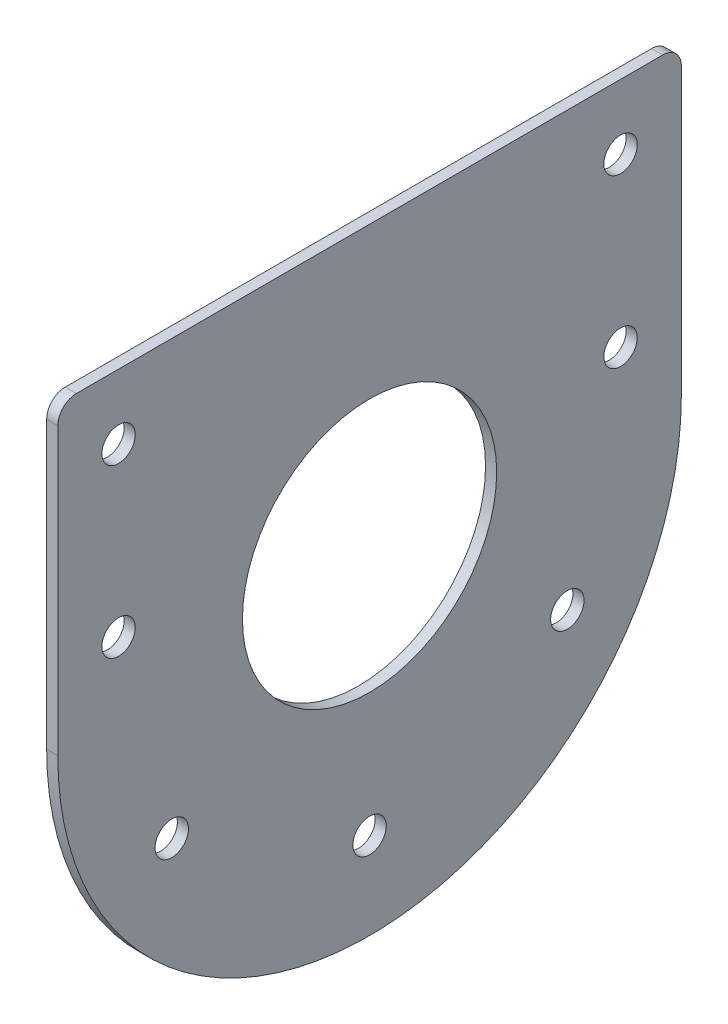
from build123d import *

# Parameters (mm, degrees)
SM_START               = -3
SM_BASE_FLANGE_1_DEPTH = 6
SKETCH_6_R             = 9
SKETCH_6_R_2           = 68.5
CUT_EXTRUDE_1_DEPTH    = 248.757946391
FILLET_1_R             = 10


# Read off the part's stored shape, not the designer's step: Базовая кромка1
with BuildPart() as part:
    # Базовая кромка1 outline → Базовая кромка1 (new body)
    with BuildSketch(Plane(origin=(0, 0, 0), x_dir=(0, 0, -1), z_dir=(1, 0, 0)).offset(SM_START)):
        with BuildLine():
            Line((168, -14), (168, 150))
            Line((168, 150), (-168, 150))
            Line((-168, 150), (-168, -14))
            ThreePointArc((-168, -14), (0, -182), (168, -14))
        make_face()
    extrude(amount=SM_BASE_FLANGE_1_DEPTH)

    # Эскиз6 → Вырез-Вытянуть1 (cut, through all)
    with BuildSketch(Plane(origin=(3, 0, 0), x_dir=(0, 0, -1), z_dir=(1, 0, 0))):
        with Locations((-135.25, 115)):
            Circle(SKETCH_6_R)
        with Locations((-106.578454425, -83.268214538)):
            Circle(SKETCH_6_R)
        with Locations((0, -135.25)):
            Circle(SKETCH_6_R)
        with Locations((106.578454425, -83.268214538)):
            Circle(SKETCH_6_R)
        with Locations((135.25, 115)):
            Circle(SKETCH_6_R)
        Circle(SKETCH_6_R_2)
        with Locations((-135.25, 25)):
            Circle(SKETCH_6_R)
        with Locations((135.25, 25)):
            Circle(SKETCH_6_R)
    extrude(amount=-CUT_EXTRUDE_1_DEPTH, mode=Mode.SUBTRACT)

    # Скругление1
    fillet_1_edges = [part.edges().sort_by_distance(p)[0] for p in [
        (0, 150, -168),
        (0, 150, 168),
    ]]
    fillet(fillet_1_edges, radius=FILLET_1_R)


solid = part.part
